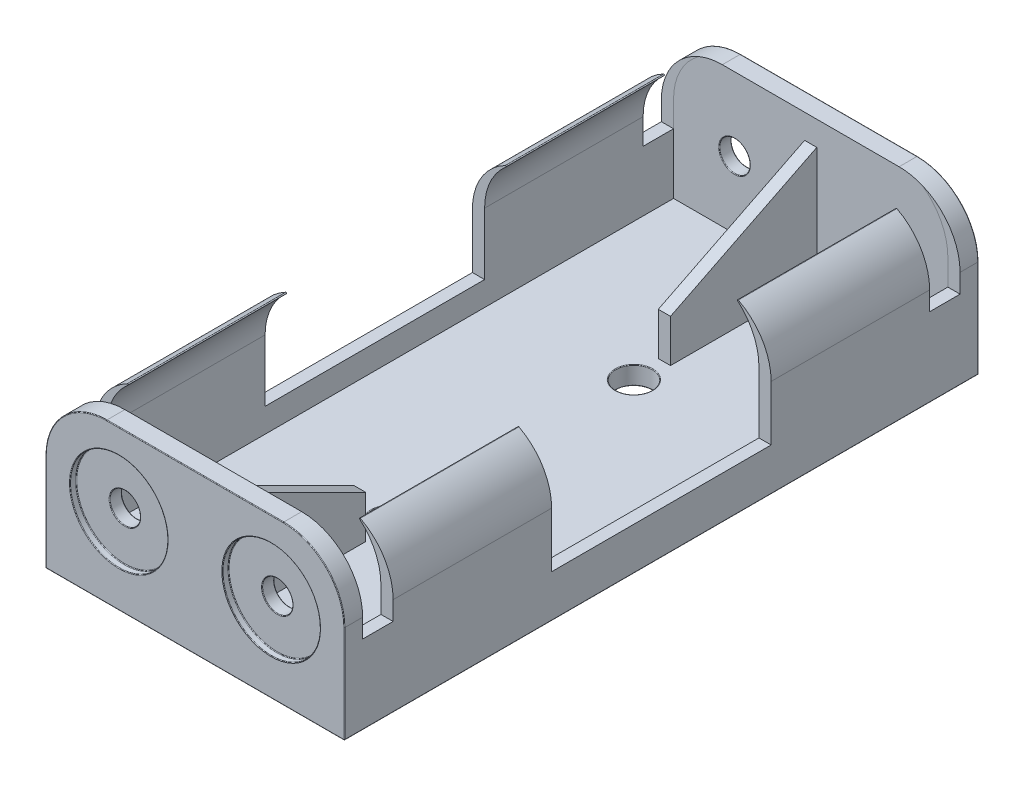
from build123d import *

# Parameters (mm, degrees)
DODANIE_WYCI_GNI_CIE3_DEPTH      = 26
DODANIE_WYCI_GNI_CIE3_DEPTH_BACK = 26
SZKIC_3D1_R                      = 1.25
WYTNIJ_WYCI_GNI_CIE1_DEPTH       = 24.5
WYTNIJ_WYCI_GNI_CIE1_DEPTH_BACK  = 24.5
WYTNIJ_WYCI_GNI_CIE2_DEPTH       = 0.5
WYTNIJ_WYCI_GNI_CIE3_DEPTH       = 5
SZKIC_3D5_R                      = 1.5
WYTNIJ_WYCI_GNI_CIE4_DEPTH       = 5
WYTNIJ_WYCI_GNI_CIE5_START       = 25.5
WYTNIJ_WYCI_GNI_CIE5_OUTLINE_R   = 4
WYTNIJ_WYCI_GNI_CIE5_OUTLINE_R_2 = 1.25
WYTNIJ_WYCI_GNI_CIE5_DEPTH       = 0.5
ZAOKR_GLENIE1_R                  = 0.05
ZAOKR_GLENIE2_R                  = 0.05
ZAOKR_GLENIE3_R                  = 0.05
ZAOKR_GLENIE4_R                  = 0.05
ZAOKR_GLENIE5_R                  = 0.05
ZAOKR_GLENIE6_R                  = 0.05
ZAOKR_GLENIE7_R                  = 0.05
ZAOKR_GLENIE8_R                  = 0.05
ZAOKR_GLENIE9_R                  = 0.05
ZAOKR_GLENIE10_R                 = 0.05
ZAOKR_GLENIE11_R                 = 0.05
ZAOKR_GLENIE12_R                 = 0.05
ZAOKR_GLENIE13_R                 = 0.05
ZAOKR_GLENIE14_R                 = 0.05
ZAOKR_GLENIE15_R                 = 0.05
ZAOKR_GLENIE16_R                 = 0.05
ZAOKR_GLENIE17_R                 = 0.05
ZAOKR_GLENIE18_R                 = 0.05
ZAOKR_GLENIE19_R                 = 0.05
ZAOKR_GLENIE20_R                 = 0.05
ZAOKR_GLENIE21_R                 = 0.05
ZAOKR_GLENIE26_R                 = 0.05


# Read off the part's stored shape, not the designer's step: Wytnij-wyciągnięcie5
with BuildPart() as part:
    # Szkic 3D1 → Dodanie-wyciągnięcie3 (new, two sides: drawn at the far end of the back side and taken through both)
    with BuildSketch(Plane(origin=(-12.25, 0, 0), x_dir=(0.9506054564909805, 0.3104017817113406, 0), z_dir=(0, 0, 1)).offset(-DODANIE_WYCI_GNI_CIE3_DEPTH_BACK)):
        with BuildLine():
            Line((0, 0), (23.289833684, -7.604843652))
            Line((23.289833684, -7.604843652), (25.773047938, 0))
            ThreePointArc((25.773047938, 0), (25.478354502, 3.815470707), (22.572029564, 6.305036191))
            Line((22.572029564, 6.305036191), (8.788250445, 10.805862026))
            ThreePointArc((8.788250445, 10.805862026), (4.972779737, 10.51116859), (2.483214254, 7.604843652))
            Line((2.483214254, 7.604843652), (0, 0))
        make_face()
        with Locations(Location((19.759013417, 0.911805234, 0), (0, 0, 161.916554617))):
            Circle(SZKIC_3D1_R, mode=Mode.SUBTRACT)
        with Locations(Location((7.876445211, 4.791827505, 0), (0, 0, 161.916554617))):
            Circle(SZKIC_3D1_R, mode=Mode.SUBTRACT)
    extrude(amount=DODANIE_WYCI_GNI_CIE3_DEPTH + DODANIE_WYCI_GNI_CIE3_DEPTH_BACK)

    # Szkic 3D2 → Wytnij-wyciągnięcie1 (cut, two sides: drawn at the far end of the back side and taken through both)
    with BuildSketch(Plane(origin=(0.5, 1.5, 0), x_dir=(-0.48849758700314805, 0.8725652454069562, 0), z_dir=(0, 0, -1)).offset(-WYTNIJ_WYCI_GNI_CIE1_DEPTH_BACK)):
        with BuildLine():
            Line((0, 0), (-5.25134906, 9.380076388))
            Line((-5.25134906, 9.380076388), (0.906343877, 12.82740386))
            ThreePointArc((0.906343877, 12.82740386), (4.70671604, 13.276661425), (7.711658039, 10.907065568))
            Line((7.711658039, 10.907065568), (10.520519164, 5.889815406))
            Line((10.520519164, 5.889815406), (0, 0))
        make_face()
        with BuildLine():
            Line((5.739846647, -10.252641634), (11.897539584, -6.805314162))
            ThreePointArc((11.897539584, -6.805314162), (14.267135441, -3.800372163), (13.817877876, 0))
            Line((13.817877876, 0), (11.009016751, 5.017250161))
            Line((11.009016751, 5.017250161), (0.488497587, -0.872565245))
            Line((0.488497587, -0.872565245), (5.739846647, -10.252641634))
        make_face()
    extrude(amount=WYTNIJ_WYCI_GNI_CIE1_DEPTH + WYTNIJ_WYCI_GNI_CIE1_DEPTH_BACK, mode=Mode.SUBTRACT)

    # Szkic 3D3 → Wytnij-wyciągnięcie2 (cut, symmetric)
    with BuildSketch(Plane(origin=(0, 1.5, -12.5), x_dir=(0, 0.29680508017942747, 0.9549380840555495), z_dir=(-1, 0, 0))):
        Polygon((0, 0), (1.038817781, 3.342283294), (-8.639608747, 12.633572761), (-8.045998587, 14.543448929), (38.745967532, 0), (38.152357372, -1.909876168), (24.912269882, -4.07784371), (23.873452101, -7.420127004), align=None)
    extrude(amount=WYTNIJ_WYCI_GNI_CIE2_DEPTH, both=True, mode=Mode.SUBTRACT)

    # Szkic 3D4 → Wytnij-wyciągnięcie3 (cut)
    with BuildSketch(Plane(origin=(12.25, 3.485434748, 0), x_dir=(0, 0.3928396043672502, 0.9196070058674969), z_dir=(-1, 0, 0))):
        Polygon((0, 0), (8.276463053, -3.535556439), (12.008439294, 5.200710116), (3.729073145, 8.737506707), (-4.547389908, 12.273063146), (-8.27936615, 3.53679659), align=None)
        Polygon((21.396500798, -5.914953429), (24.342797831, 0.982099115), (26.641815589, 0), (23.695518556, -6.897052544), align=None)
        Polygon((-21.365185846, 12.352070027), (-18.418888814, 19.249122571), (-16.122814041, 18.268280647), (-19.069111074, 11.371228103), align=None)
    wytnij_wyci_gni_cie3 = extrude(amount=WYTNIJ_WYCI_GNI_CIE3_DEPTH, mode=Mode.SUBTRACT)

    # Lustro1: Wytnij-wyciągnięcie3 across plane
    add(wytnij_wyci_gni_cie3.mirror(Plane(origin=(0, 0, 0), x_dir=(0, 0, 1), z_dir=(1, 0, 0))), mode=Mode.SUBTRACT)

    # Szkic 3D5 → Wytnij-wyciągnięcie4 (cut)
    with BuildSketch(Plane(origin=(0, 0, 0), x_dir=(0, 0, -1), z_dir=(0, -1, 0))):
        with Locations(Location((10, 0, 0), (0, 0, 180))):
            Circle(SZKIC_3D5_R)
        with Locations(Location((-10, 0, 0), (0, 0, 180))):
            Circle(SZKIC_3D5_R)
    extrude(amount=-WYTNIJ_WYCI_GNI_CIE4_DEPTH, mode=Mode.SUBTRACT)

    # Wytnij-wyciągnięcie5 outline → Wytnij-wyciągnięcie5 (cut)
    # profile 1 of 2: a face of its own
    with BuildSketch(Plane.XY.offset(WYTNIJ_WYCI_GNI_CIE5_START)):
        with Locations((-6.25, 7)):
            Circle(WYTNIJ_WYCI_GNI_CIE5_OUTLINE_R)
        with Locations((-6.25, 7)):
            Circle(WYTNIJ_WYCI_GNI_CIE5_OUTLINE_R_2, mode=Mode.SUBTRACT)
    # profile 2 of 2: a face of its own
    with BuildSketch(Plane.XY.offset(WYTNIJ_WYCI_GNI_CIE5_START)):
        with Locations((6.25, 7)):
            Circle(WYTNIJ_WYCI_GNI_CIE5_OUTLINE_R)
        with Locations((6.25, 7)):
            Circle(WYTNIJ_WYCI_GNI_CIE5_OUTLINE_R_2, mode=Mode.SUBTRACT)
    wytnij_wyci_gni_cie5 = extrude(amount=WYTNIJ_WYCI_GNI_CIE5_DEPTH, mode=Mode.SUBTRACT)

    # Lustro2: Wytnij-wyciągnięcie5 across plane
    add(wytnij_wyci_gni_cie5.mirror(Plane.XY), mode=Mode.SUBTRACT)

    # Zaokrąglenie1
    zaokr_glenie1_edges = [part.edges().sort_by_distance(p)[0] for p in [
        (2.25, 7, -26),
    ]]
    fillet(zaokr_glenie1_edges, radius=ZAOKR_GLENIE1_R)

    # Zaokrąglenie2
    zaokr_glenie2_edges = [part.edges().sort_by_distance(p)[0] for p in [
        (-10.25, 7, -25.5),
    ]]
    fillet(zaokr_glenie2_edges, radius=ZAOKR_GLENIE2_R)

    # Zaokrąglenie3
    zaokr_glenie3_edges = [part.edges().sort_by_distance(p)[0] for p in [
        (2.25, 7, -25.5),
    ]]
    fillet(zaokr_glenie3_edges, radius=ZAOKR_GLENIE3_R)

    # Zaokrąglenie4
    zaokr_glenie4_edges = [part.edges().sort_by_distance(p)[0] for p in [
        (2.25, 7, 25.5),
    ]]
    fillet(zaokr_glenie4_edges, radius=ZAOKR_GLENIE4_R)

    # Zaokrąglenie5
    zaokr_glenie5_edges = [part.edges().sort_by_distance(p)[0] for p in [
        (-10.25, 7, 25.5),
    ]]
    fillet(zaokr_glenie5_edges, radius=ZAOKR_GLENIE5_R)

    # Zaokrąglenie6
    zaokr_glenie6_edges = [part.edges().sort_by_distance(p)[0] for p in [
        (0, 1.5, -11.5),
    ]]
    fillet(zaokr_glenie6_edges, radius=ZAOKR_GLENIE6_R)

    # Zaokrąglenie7
    zaokr_glenie7_edges = [part.edges().sort_by_distance(p)[0] for p in [
        (0, 1.5, 8.5),
    ]]
    fillet(zaokr_glenie7_edges, radius=ZAOKR_GLENIE7_R)

    # Zaokrąglenie8
    zaokr_glenie8_edges = [part.edges().sort_by_distance(p)[0] for p in [
        (7.5, 7, 25.5),
    ]]
    fillet(zaokr_glenie8_edges, radius=ZAOKR_GLENIE8_R)

    # Zaokrąglenie9
    zaokr_glenie9_edges = [part.edges().sort_by_distance(p)[0] for p in [
        (-5, 7, -25.5),
    ]]
    fillet(zaokr_glenie9_edges, radius=ZAOKR_GLENIE9_R)

    # Zaokrąglenie10
    zaokr_glenie10_edges = [part.edges().sort_by_distance(p)[0] for p in [
        (-5, 7, 25.5),
    ]]
    fillet(zaokr_glenie10_edges, radius=ZAOKR_GLENIE10_R)

    # Zaokrąglenie11
    zaokr_glenie11_edges = [part.edges().sort_by_distance(p)[0] for p in [
        (7.5, 7, -25.5),
    ]]
    fillet(zaokr_glenie11_edges, radius=ZAOKR_GLENIE11_R)

    # Zaokrąglenie12
    zaokr_glenie12_edges = [part.edges().sort_by_distance(p)[0] for p in [
        (-12.25, 4, 26),
        (0, 0, 26),
        (12.25, 4, 26),
        (0, 13, 26),
        (-12.25, 4, -26),
        (0, 0, -26),
        (12.25, 4, -26),
        (0, 13, -26),
        (12.25, 0, 0),
        (-12.25, 0, 0),
    ]]
    fillet(zaokr_glenie12_edges, radius=ZAOKR_GLENIE12_R)

    # Zaokrąglenie13
    zaokr_glenie13_edges = [part.edges().sort_by_distance(p)[0] for p in [
        (7.5, 7, 24.5),
    ]]
    fillet(zaokr_glenie13_edges, radius=ZAOKR_GLENIE13_R)

    # Zaokrąglenie14
    zaokr_glenie14_edges = [part.edges().sort_by_distance(p)[0] for p in [
        (-5, 7, 24.5),
    ]]
    fillet(zaokr_glenie14_edges, radius=ZAOKR_GLENIE14_R)

    # Zaokrąglenie15
    zaokr_glenie15_edges = [part.edges().sort_by_distance(p)[0] for p in [
        (-5, 7, -24.5),
    ]]
    fillet(zaokr_glenie15_edges, radius=ZAOKR_GLENIE15_R)

    # Zaokrąglenie16
    zaokr_glenie16_edges = [part.edges().sort_by_distance(p)[0] for p in [
        (7.5, 7, -24.5),
    ]]
    fillet(zaokr_glenie16_edges, radius=ZAOKR_GLENIE16_R)

    # Zaokrąglenie17
    zaokr_glenie17_edges = [part.edges().sort_by_distance(p)[0] for p in [
        (0, 0, -11.5),
    ]]
    fillet(zaokr_glenie17_edges, radius=ZAOKR_GLENIE17_R)

    # Zaokrąglenie18
    zaokr_glenie18_edges = [part.edges().sort_by_distance(p)[0] for p in [
        (0, 0, 8.5),
    ]]
    fillet(zaokr_glenie18_edges, radius=ZAOKR_GLENIE18_R)

    # Zaokrąglenie19
    zaokr_glenie19_edges = [part.edges().sort_by_distance(p)[0] for p in [
        (2.25, 7, 26),
    ]]
    fillet(zaokr_glenie19_edges, radius=ZAOKR_GLENIE19_R)

    # Zaokrąglenie20
    zaokr_glenie20_edges = [part.edges().sort_by_distance(p)[0] for p in [
        (-10.25, 7, 26),
    ]]
    fillet(zaokr_glenie20_edges, radius=ZAOKR_GLENIE20_R)

    # Zaokrąglenie21
    zaokr_glenie21_edges = [part.edges().sort_by_distance(p)[0] for p in [
        (-10.25, 7, -26),
    ]]
    fillet(zaokr_glenie21_edges, radius=ZAOKR_GLENIE21_R)

    # Zaokrąglenie26
    zaokr_glenie26_edges = [part.edges().sort_by_distance(p)[0] for p in [
        (9.167042616, 12.617894283, 15.5),
        (9.167042616, 12.617894283, -15.503156889),
        (-9.167042616, 12.617894283, 15.5),
        (-9.167042616, 12.617894283, -15.503156889),
    ]]
    fillet(zaokr_glenie26_edges, radius=ZAOKR_GLENIE26_R)


solid = part.part
